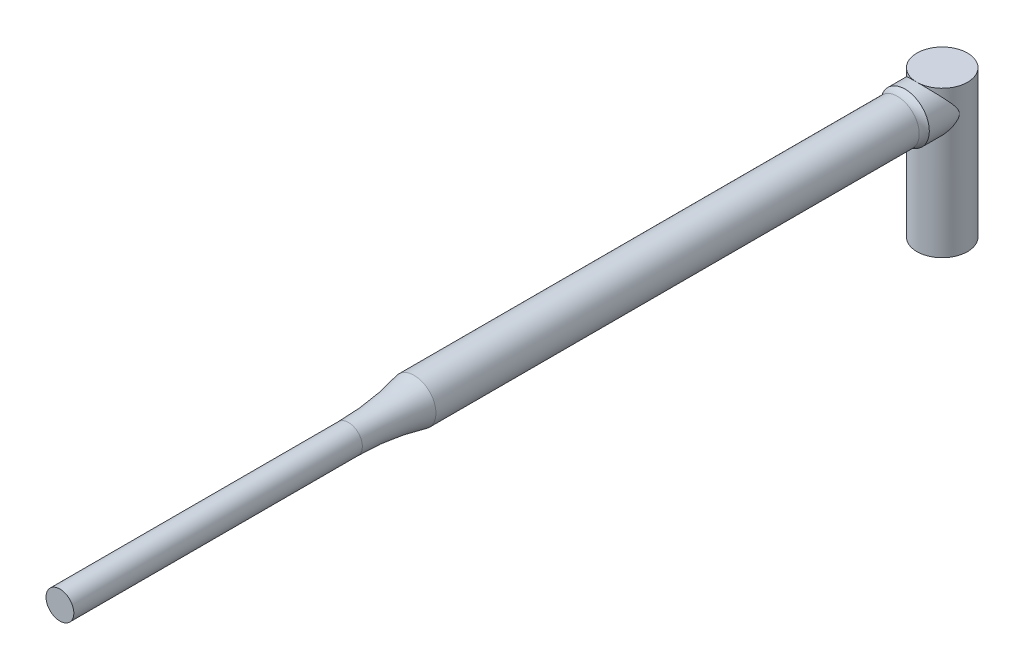
from build123d import *

# Parameters (mm, degrees)
SKETCH1_R           = 5
BOSS_EXTRUDE1_DEPTH = 29
SKETCH2_R           = 4.8
BOSS_EXTRUDE2_DEPTH = 7.35
SKETCH3_R           = 4.305
BOSS_EXTRUDE3_DEPTH = 97
SKETCH4_R           = 2.75
BOSS_EXTRUDE4_DEPTH = 70
FILLET1_R           = 55
FILLET2_R           = 2.5


with BuildPart() as part:
    # Sketch1 → Boss-Extrude1 (new body)
    with BuildSketch(Plane(origin=(0, 0, 0), x_dir=(1, 0, 0), z_dir=(0, 1, 0))):
        with Locations(Location((0, 0, 0), (0, 0, 90))):
            Circle(SKETCH1_R)
    extrude(amount=BOSS_EXTRUDE1_DEPTH)

    # Sketch2 → Boss-Extrude2 (add)
    with BuildSketch(Plane.XY):
        with Locations(Location((0, 24.2, 0), (0, 0, 90))):
            Circle(SKETCH2_R)
    extrude(amount=BOSS_EXTRUDE2_DEPTH)

    # Sketch3 → Boss-Extrude3 (add)
    with BuildSketch(Plane.XY.offset(7.35)):
        with Locations(Location((0, 24.2, 0), (0, 0, 180))):
            Circle(SKETCH3_R)
    extrude(amount=BOSS_EXTRUDE3_DEPTH)

    # Sketch4 → Boss-Extrude4 (add)
    with BuildSketch(Plane.XY.offset(104.35)):
        with Locations((0, 24.2)):
            Circle(SKETCH4_R)
    extrude(amount=BOSS_EXTRUDE4_DEPTH)

    # Fillet1
    # the kernel refuses this fillet: 55 mm, written as the material it adds along each edge
    with BuildSketch(Plane(origin=(0, 24.2, 104.35), x_dir=(1, 0, 0), z_dir=(0, -1, 0))) as fillet1_piece_1:
        with BuildLine():
            CenterArc((57.75, 12.985837478), FILLET1_R, 180, 13.656834666)
            Line((2.75, 12.985837478), (1.65, 12.985837478))
            Line((1.65, 12.985837478), (1.65, 0))
            Line((1.65, 0), (2.75, -1.1))
            ThreePointArc((2.75, -1.1), (3.5275, -1.1), (3.2361, -0.25971675))
            Line((3.2361, -0.25971675), (4.305, 0))
        make_face()
    revolve(axis=Axis((0, 24.2, 104.35), (0, 0, 1)))

    # Fillet2
    # the kernel refuses this fillet: 2.5 mm, written as the material it adds along each edge
    with BuildSketch(Plane(origin=(0, 24.2, 7.35), x_dir=(-1, 0, 0), z_dir=(0, 1, 0))) as fillet2_piece_1:
        with BuildLine():
            CenterArc((6.805, 1.493310082), FILLET2_R, 180, 36.678485047)
            Line((4.8, 0), (4.7599, -0.029866202))
            ThreePointArc((4.7599, -0.029866202), (4.5525, -0.05), (4.305, -0.05))
            Line((4.305, -0.05), (4.255, 0))
            Line((4.255, 0), (4.255, 1.493310082))
            Line((4.255, 1.493310082), (4.305, 1.493310082))
        make_face()
    revolve(axis=Axis((0, 24.2, 7.35), (0, 0, 1)))


solid = part.part
